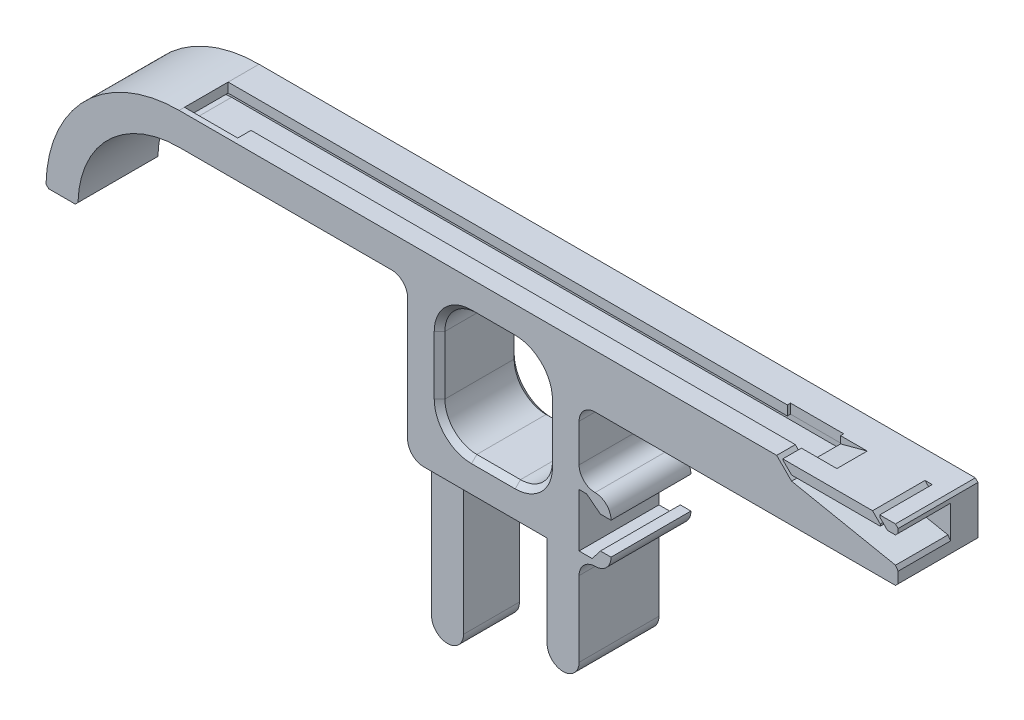
from build123d import *
from OCP.BRepFilletAPI import BRepFilletAPI_MakeChamfer

# Parameters (mm, degrees)
BOSS_EXTRUDE1_DEPTH = 15
BOSS_EXTRUDE2_DEPTH = 15
SKETCH6_W           = 115
SKETCH6_H           = 1
CUT_EXTRUDE2_DEPTH  = 9.85
CUT_EXTRUDE3_DEPTH  = 9.85
CUT_EXTRUDE4_DEPTH  = 9.85
BOSS_EXTRUDE3_DEPTH = 1
CUT_EXTRUDE5_REACH  = 117.913
SKETCH10_W          = 115
SKETCH10_H          = 5.7
SKETCH13_W          = 20.2
SKETCH13_H          = 23
CUT_EXTRUDE6_DEPTH  = 111.121977825
FILLET1_R           = 6
SKETCH14_W          = 6
SKETCH14_H          = 31
CUT_EXTRUDE7_DEPTH  = 4.5
FILLET2_R           = 3
SKETCH16_W          = 10
SKETCH16_H          = 2.5
CUT_EXTRUDE8_DEPTH  = 1.8
CHAMFER1_SIZE       = 0.5
CHAMFER1_SIZE_2     = 0.637377439
CHAMFER2_SIZE       = 1
CHAMFER3_SIZE       = 5
CHAMFER3_SIZE2      = 1.339745962
CUT_EXTRUDE12_REACH = 112.118
CHAMFER4_SIZE       = 0.2
CHAMFER4_SIZE_2     = 0.141421356
SKETCH25_W          = 6
SKETCH25_H          = 12
BOSS_EXTRUDE6_DEPTH = 15
FILLET4_START       = -1
FILLET4_DEPTH       = 16
FILLET4_2_DEPTH     = 15
CUT_EXTRUDE15_DEPTH = 15
CUT_EXTRUDE16_DEPTH = 9.85
CHAMFER5_SIZE       = 0.5
CHAMFER5_SIZE2      = 0.353553391
CHAMFER6_SIZE       = 0.5
SKETCH29_W          = 10
SKETCH29_H          = 0.6
CUT_EXTRUDE17_DEPTH = 2.8


with BuildPart() as part:
    # Sketch3 → Boss-Extrude1 (new body)
    with BuildSketch(Plane.XY):
        Polygon((0, 0), (0, 20.2), (-20.2, 20.2), (-20.2, -10.8), (-26.2, -10.8), (-26.2, 49.2), (-69.1, 49.2), (-69.1, 55.2), (5.9, 55.2), (65.9, 55.2), (65.9, 45.2), (6, 45.2), (6, 0), align=None)
    extrude(amount=BOSS_EXTRUDE1_DEPTH)

    # Sketch4 → Boss-Extrude2 (add)
    with BuildSketch(Plane.XY.offset(15)):
        with BuildLine():
            Line((-88.1, 30.2), (-94.1, 30.2))
            ThreePointArc((-94.1, 30.2), (-86.77766953, 47.87766953), (-69.1, 55.2))
            Line((-69.1, 55.2), (-69.1, 49.2))
            ThreePointArc((-69.1, 49.2), (-82.535028843, 43.635028843), (-88.1, 30.2))
        make_face()
    extrude(amount=-BOSS_EXTRUDE2_DEPTH)

    # Sketch6 → Cut-Extrude2 (cut)
    with BuildSketch(Plane.XY.offset(15)):
        with Locations((-11.6, 52.9)):
            Rectangle(SKETCH6_W, SKETCH6_H)
    extrude(amount=-CUT_EXTRUDE2_DEPTH, mode=Mode.SUBTRACT)

    # Sketch7 → Cut-Extrude3 (cut)
    with BuildSketch(Plane.XY.offset(15)):
        with BuildLine():
            Line((-92.3, 30.2), (-91.3, 30.2))
            ThreePointArc((-91.3, 30.2), (-84.797770542, 45.897770542), (-69.1, 52.4))
            Line((-69.1, 52.4), (-69.1, 53.4))
            ThreePointArc((-69.1, 53.4), (-85.504877324, 46.604877324), (-92.3, 30.2))
        make_face()
    extrude(amount=-CUT_EXTRUDE3_DEPTH, mode=Mode.SUBTRACT)

    # Sketch8 → Cut-Extrude4 (cut)
    with BuildSketch(Plane.XY.offset(15)):
        Polygon((45.9, 53.4), (65.9, 53.4), (65.9, 48.4), (45.9, 52.4), align=None)
    extrude(amount=-CUT_EXTRUDE4_DEPTH, mode=Mode.SUBTRACT)

    # Sketch9 → Boss-Extrude3 (add)
    with BuildSketch(Plane.XY.offset(15)):
        with BuildLine():
            Line((-69.1, 52.4), (45.9, 52.4))
            Line((45.9, 52.4), (45.9, 53.4))
            Line((45.9, 53.4), (-69.1, 53.4))
            ThreePointArc((-69.1, 53.4), (-85.504877324, 46.604877324), (-92.3, 30.2))
            Line((-92.3, 30.2), (-91.3, 30.2))
            ThreePointArc((-91.3, 30.2), (-84.797770542, 45.897770542), (-69.1, 52.4))
        make_face()
    extrude(amount=-BOSS_EXTRUDE3_DEPTH)

    # Cut-Extrude5: up to this face of the body (flat: up to its plane)
    cut_extrude5_end = Plane(part.part.faces().sort_by_distance((-11.6, 52.4, 9.575))[0])
    # Sketch10 → Cut-Extrude5 (cut, up to the picked face)
    with BuildSketch(Plane(origin=(0, 55.2, 0), x_dir=(-1, 0, 0), z_dir=(0, 1, 0)), mode=Mode.PRIVATE) as cut_extrude5_sk1:
        with Locations((11.6, 8.65)):
            Rectangle(SKETCH10_W, SKETCH10_H)
    cut_extrude5_tool1 = split(extrude(cut_extrude5_sk1.sketch, amount=-CUT_EXTRUDE5_REACH, mode=Mode.PRIVATE), bisect_by=cut_extrude5_end, keep=Keep.BOTH, mode=Mode.PRIVATE)
    add(cut_extrude5_tool1.solids().sort_by(Axis((-11.6, 55.2, 8.65), (0, -1, 0)))[0], mode=Mode.SUBTRACT)

    # Sketch13 → Cut-Extrude6 (cut, through all)
    with BuildSketch(Plane.XY.offset(15)):
        with Locations((-10.1, 37.7)):
            Rectangle(SKETCH13_W, SKETCH13_H)
    extrude(amount=-CUT_EXTRUDE6_DEPTH, mode=Mode.SUBTRACT)

    # Fillet1
    fillet1_edges = [part.edges().sort_by_distance(p)[0] for p in [
        (-20.2, 26.2, 7.5),
        (-20.2, 49.2, 7.5),
        (0, 49.2, 7.5),
        (0, 26.2, 7.5),
    ]]
    fillet(fillet1_edges, radius=FILLET1_R)

    # Sketch14 → Cut-Extrude7 (cut)
    with BuildSketch(Plane.XY.offset(15)):
        with Locations((-23.2, 4.7)):
            Rectangle(SKETCH14_W, SKETCH14_H)
    extrude(amount=-CUT_EXTRUDE7_DEPTH, mode=Mode.SUBTRACT)

    # Fillet2
    fillet2_edges = [part.edges().sort_by_distance(p)[0] for p in [
        (-26.2, 49.2, 7.5),
        (6, 45.2, 7.5),
        (-26.2, 20.2, 12.75),
        (6, 0, 7.5),
        (0, 0, 7.5),
        (-20.2, -10.8, 5.25),
        (-26.2, -10.8, 5.25),
    ]]
    fillet(fillet2_edges, radius=FILLET2_R - 0.0001)  # a hair under: the kernel refuses the full size

    # Sketch16 → Cut-Extrude8 (cut)
    with BuildSketch(Plane(origin=(0, 55.2, 0), x_dir=(-1, 0, 0), z_dir=(0, 1, 0))):
        with Locations((64.1, 12.75)):
            Rectangle(SKETCH16_W, SKETCH16_H)
    extrude(amount=-CUT_EXTRUDE8_DEPTH, mode=Mode.SUBTRACT)

    # Chamfer1
    # the kernel refuses this chamfer: 0.637377439, 0.5 mm, written as the material it takes off along each edge
    with BuildSketch(Plane(origin=(65.9, 55.2, -1.285841494), x_dir=(-1, 0, 0), z_dir=(0, 0, 1)), Plane(origin=(65.9, 45.2, -1.285841494), x_dir=(0, 1, 0), z_dir=(0, 0, 1))) as chamfer1_piece_1:
        Polygon((CHAMFER1_SIZE, 0), (0, CHAMFER1_SIZE), (0, 0), align=None)
    extrude(amount=17.571682988, mode=Mode.SUBTRACT)
    with BuildSketch(Plane(origin=(-88.1, 30.2, 16.303301327), x_dir=(-1, 0, 0), z_dir=(0, 0, -1))) as chamfer1_piece_2:
        with BuildLine():
            Line((CHAMFER1_SIZE, 0), (-0.006759226, 0.506759226))
            ThreePointArc((-0.006759226, 0.506759226), (-0.001786833, 0.26056951), (0, 0))
            Line((0, 0), (CHAMFER1_SIZE, 0))
        make_face()
    extrude(amount=17.606602654, mode=Mode.SUBTRACT)
    with BuildSketch(Plane(origin=(-94.1, 30.2, 16.285841494), x_dir=(1, 0, 0), z_dir=(0, 0, -1))) as chamfer1_piece_3:
        with BuildLine():
            Line((CHAMFER1_SIZE, 0), (0.004902903, -0.495097097))
            ThreePointArc((0.004902903, -0.495097097), (0.001296043, -0.254559377), (0, 0))
            Line((0, 0), (CHAMFER1_SIZE, 0))
        make_face()
    extrude(amount=17.571682988, mode=Mode.SUBTRACT)
    with BuildSketch(Plane(origin=(65.9, 53.4, 16.285841494), x_dir=(-1, 0, 0), z_dir=(0, 0, -1))) as chamfer1_piece_4:
        Polygon((CHAMFER1_SIZE, 0), (0, CHAMFER1_SIZE), (0, 0), align=None)
    extrude(amount=11.135841494, mode=Mode.SUBTRACT)
    with BuildSketch(Plane(origin=(65.9, 48.4, 16.646856161), x_dir=(-0.9805806756909208, 0.1961161351381813, 0), z_dir=(0, 0, -1))) as chamfer1_piece_5:
        Polygon((CHAMFER1_SIZE, 0), (-CHAMFER1_SIZE_2 * 0.196116135199, -CHAMFER1_SIZE_2 * 0.980580675997), (0, 0), align=None)
    extrude(amount=11.496856161, mode=Mode.SUBTRACT)

    # Chamfer2
    chamfer2_edges = [part.edges().sort_by_distance(p)[0] for p in [
        (-10.1, 49.2, 15),
        (-10.1, 49.2, 0),
        (0, 37.7, 15),
        (0, 37.7, 0),
        (-10.1, 26.2, 15),
        (-10.1, 26.2, 0),
        (-20.2, 37.7, 15),
        (-20.2, 37.7, 0),
        (-1.757359313, 47.442640687, 15),
        (-1.757359313, 47.442640687, 0),
        (-1.757359313, 27.957359313, 15),
        (-1.757359313, 27.957359313, 0),
        (-18.442640687, 27.957359313, 15),
        (-18.442640687, 27.957359313, 0),
        (-18.442640687, 47.442640687, 15),
        (-18.442640687, 47.442640687, 0),
    ]]
    chamfer(chamfer2_edges, length=CHAMFER2_SIZE)

    # Chamfer3
    chamfer3_edges = [part.edges().sort_by_distance(p)[0] for p in [
        (45.9, 55.2, 8.65),
    ]]
    chamfer3_side = [part.faces().sort_by_distance(p)[0] for p in [
        (64.046661535, 55.2, 7.5),
    ]]
    chamfer(chamfer3_edges, length=CHAMFER3_SIZE, length2=CHAMFER3_SIZE2, reference=chamfer3_side[0])

    # Cut-Extrude12: up to this face of the body (flat: up to its plane)
    cut_extrude12_end = Plane(part.part.faces().sort_by_distance((-5.656799941, 54.307895333, 11.5))[0])
    # Sketch20 → Cut-Extrude12 (cut, up to the picked face)
    with BuildSketch(Plane.XY.offset(15), mode=Mode.PRIVATE) as cut_extrude12_sk1:
        Polygon((45.9, 52.4), (43.1, 55.2), (44.1, 55.2), (45.9, 53.4), align=None)
    cut_extrude12_tool1 = split(extrude(cut_extrude12_sk1.sketch, amount=-CUT_EXTRUDE12_REACH, mode=Mode.PRIVATE), bisect_by=cut_extrude12_end, keep=Keep.BOTH, mode=Mode.PRIVATE)
    add(cut_extrude12_tool1.solids().sort_by(Axis((44.731884, 54.031884, 15), (0, 0, -1)))[0], mode=Mode.SUBTRACT)

    # Chamfer4
    # the kernel refuses this chamfer: 0.2, 0.141421356 mm, written as the material it takes off along each edge
    with BuildSketch(Plane(origin=(44.9, 53.4, 10.985663402), x_dir=(-0.7071067811865297, 0.7071067811865652, 0), z_dir=(0, 0, 1))) as chamfer4_piece_1:
        Polygon((CHAMFER4_SIZE, 0), (CHAMFER4_SIZE_2 * 0.707106782373, CHAMFER4_SIZE_2 * 0.707106782373), (0, 0), align=None)
    extrude(amount=3.014336598, mode=Mode.SUBTRACT)
    with BuildSketch(Plane(origin=(44.1, 55.2, 15.514336598), x_dir=(1, 0, 0), z_dir=(0, 0, -1))) as chamfer4_piece_2:
        Polygon((CHAMFER4_SIZE_2 * 1.00000000168, 0), (CHAMFER4_SIZE * 0.707106781187, CHAMFER4_SIZE * 0.707106781186), (0, 0), align=None)
    extrude(amount=4.528673195, mode=Mode.SUBTRACT)

    # Sketch25 → Boss-Extrude6 (add)
    with BuildSketch(Plane.XY.offset(15)):
        with Locations((9, 26.1)):
            Rectangle(SKETCH25_W, SKETCH25_H)
    extrude(amount=-BOSS_EXTRUDE6_DEPTH)

    # Fillet4: read off the stored shape, not the designer's step
    # Fillet4 outline → Fillet4 (cut)
    with BuildSketch(Plane.XY.offset(FILLET4_START)):
        with BuildLine():
            ThreePointArc((9, 32.1), (11.121320344, 31.221320344), (12, 29.1))
            Line((12, 29.1), (12, 32.1))
            Line((12, 32.1), (9, 32.1))
        make_face()
        with BuildLine():
            ThreePointArc((12, 23.1), (11.121320344, 20.978679656), (9, 20.1))
            Line((9, 20.1), (12, 20.1))
            Line((12, 20.1), (12, 23.1))
        make_face()
    extrude(amount=FILLET4_DEPTH, mode=Mode.SUBTRACT)

    # Fillet4 2 outline → Fillet4 2 (add)
    with BuildSketch(Plane.XY):
        with BuildLine():
            Line((6, 32.1), (9, 32.1))
            ThreePointArc((9, 32.1), (6.878679656, 32.978679656), (6, 35.1))
            Line((6, 35.1), (6, 32.1))
        make_face()
        with BuildLine():
            ThreePointArc((6, 17.1), (6.878679656, 19.221320344), (9, 20.1))
            Line((9, 20.1), (6, 20.1))
            Line((6, 20.1), (6, 17.1))
        make_face()
    extrude(amount=FILLET4_2_DEPTH)

    # Sketch26 → Cut-Extrude15 (cut)
    with BuildSketch(Plane.XY.offset(15)):
        Polygon((12, 29.1), (10, 29.1), (7.402667467, 31.1), (6, 31.1), (6, 21.1), (8.459958458, 21.1), (10, 23.1), (12, 23.1), align=None)
    extrude(amount=-CUT_EXTRUDE15_DEPTH, mode=Mode.SUBTRACT)

    # Sketch27 → Cut-Extrude16 (cut)
    with BuildSketch(Plane.XY.offset(15)):
        Polygon((62.9, 53.4), (61.1, 55.2), (62.1, 55.2), (63.9, 53.4), align=None)
    extrude(amount=-CUT_EXTRUDE16_DEPTH, mode=Mode.SUBTRACT)

    # Chamfer5: one chamfer whose edges measure the first distance from different faces: ONE call of the kernel's chamfer builder (chamfer() names one face for all edges)
    chamfer5_edges_1 = [part.edges().sort_by_distance(p)[0] for p in [
        (62.9, 53.4, 10.075),
    ]]
    chamfer5_side_1 = [part.faces().sort_by_distance(p)[0] for p in [
        (62, 54.3, 10.075),
    ]]
    chamfer5_edges_2 = [part.edges().sort_by_distance(p)[0] for p in [
        (62.1, 55.2, 10.075),
    ]]
    chamfer5_side_2 = [part.faces().sort_by_distance(p)[0] for p in [
        (63, 54.3, 10.075),
    ]]
    chamfer5 = BRepFilletAPI_MakeChamfer(part.part.solid().wrapped)
    for e in chamfer5_edges_1:
        chamfer5.Add(CHAMFER5_SIZE, CHAMFER5_SIZE2, e.wrapped, chamfer5_side_1[0].wrapped)  # the first distance lies on this face
    for e in chamfer5_edges_2:
        chamfer5.Add(CHAMFER5_SIZE, CHAMFER5_SIZE2, e.wrapped, chamfer5_side_2[0].wrapped)  # the first distance lies on this face
    add(Compound.cast(chamfer5.Shape()), mode=Mode.REPLACE)

    # Chamfer6
    chamfer6_edges = [part.edges().sort_by_distance(p)[0] for p in [
        (-7.170710678, 53.4, 14),
        (-11.6, 52.4, 14),
        (-84.797770542, 45.897770542, 14),
        (-85.504877324, 46.604877324, 14),
    ]]
    chamfer(chamfer6_edges, length=CHAMFER6_SIZE - 0.0001)  # a hair under: the kernel refuses the full size

    # Sketch29 → Cut-Extrude17 (cut)
    with BuildSketch(Plane(origin=(0, 55.2, 0), x_dir=(-1, 0, 0), z_dir=(0, 1, 0))):
        with Locations((-40.9, 5.5)):
            Rectangle(SKETCH29_W, SKETCH29_H)
    extrude(amount=-CUT_EXTRUDE17_DEPTH, mode=Mode.SUBTRACT)


solid = part.part
